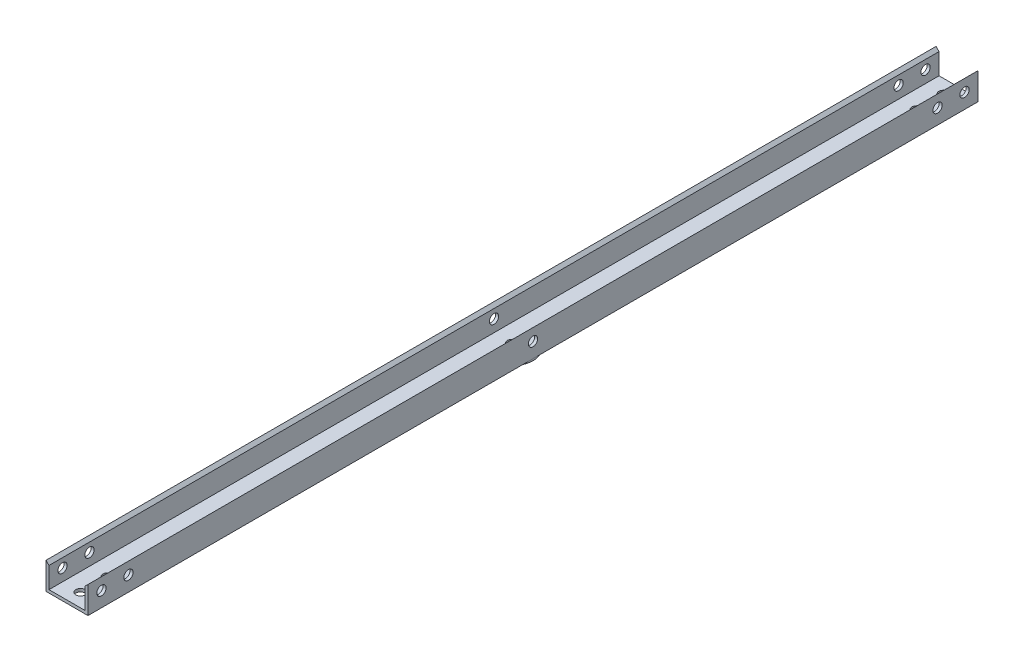
from build123d import *

# Parameters (mm, degrees)
EXTRUDE_1_DEPTH          = 1485
CHAMFER_1_SIZE           = 10
SKETCH_2_R               = 15.5
CUT_EXTRUDE_2_DEPTH      = 1495.004685401
SKETCH_4_R               = 70
EXTRUDE_4_DEPTH          = 6
CUT_EXTRUDE_3_DEPTH      = 1490.370672465
CUT_EXTRUDE_3_DEPTH_BACK = 1490.370672465
SKETCH_3_R               = 15.5


with BuildPart() as part:
    # 草图1 → 拉伸1 (new, symmetric)
    with BuildSketch(Plane.XY):
        Polygon((-70, 0), (-70, 85), (-60, 85), (-60, 5), (60, 5), (60, 85), (70, 85), (70, -5), (-70, -5), align=None)
    extrude(amount=EXTRUDE_1_DEPTH, both=True)

    # 倒角1
    chamfer_1_edges = [part.edges().sort_by_distance(p)[0] for p in [
        (60, 85, 0),
        (-60, 85, 0),
    ]]
    chamfer(chamfer_1_edges, length=CHAMFER_1_SIZE - 0.0001)  # a hair under: the kernel refuses the full size

    # 草图2 → 拉伸2 (cut, through all)
    with BuildSketch(Plane(origin=(70, 0, 0), x_dir=(0, 0, -1), z_dir=(1, 0, 0))):
        with Locations(Location((-1440, 45, 0), (0, 0, 90))):
            Circle(SKETCH_2_R)
        with Locations(Location((-1350, 45, 0), (0, 0, 90))):
            Circle(SKETCH_2_R)
        with Locations(Location((0, 45, 0), (0, 0, 90))):
            Circle(SKETCH_2_R)
        with Locations(Location((1350, 45, 0), (0, 0, 90))):
            Circle(SKETCH_2_R)
        with Locations(Location((1440, 45, 0), (0, 0, 90))):
            Circle(SKETCH_2_R)
    extrude(amount=-CUT_EXTRUDE_2_DEPTH, mode=Mode.SUBTRACT)

    # 草图4 → 拉伸4 (add)
    with BuildSketch(Plane.XZ.offset(5)):
        Circle(SKETCH_4_R)
    extrude(amount=EXTRUDE_4_DEPTH)

    # 草图3 → 拉伸3 (cut, two sides: drawn at the far end of the back side and taken through both)
    with BuildSketch(Plane.XZ.offset(5).offset(-CUT_EXTRUDE_3_DEPTH_BACK)):
        with Locations((0, -1440)):
            Circle(SKETCH_3_R)
        Circle(SKETCH_3_R)
        with Locations((0, -1350)):
            Circle(SKETCH_3_R)
        with Locations((0, 1350)):
            Circle(SKETCH_3_R)
        with Locations((0, 1440)):
            Circle(SKETCH_3_R)
    extrude(amount=CUT_EXTRUDE_3_DEPTH + CUT_EXTRUDE_3_DEPTH_BACK, mode=Mode.SUBTRACT)


solid = part.part
